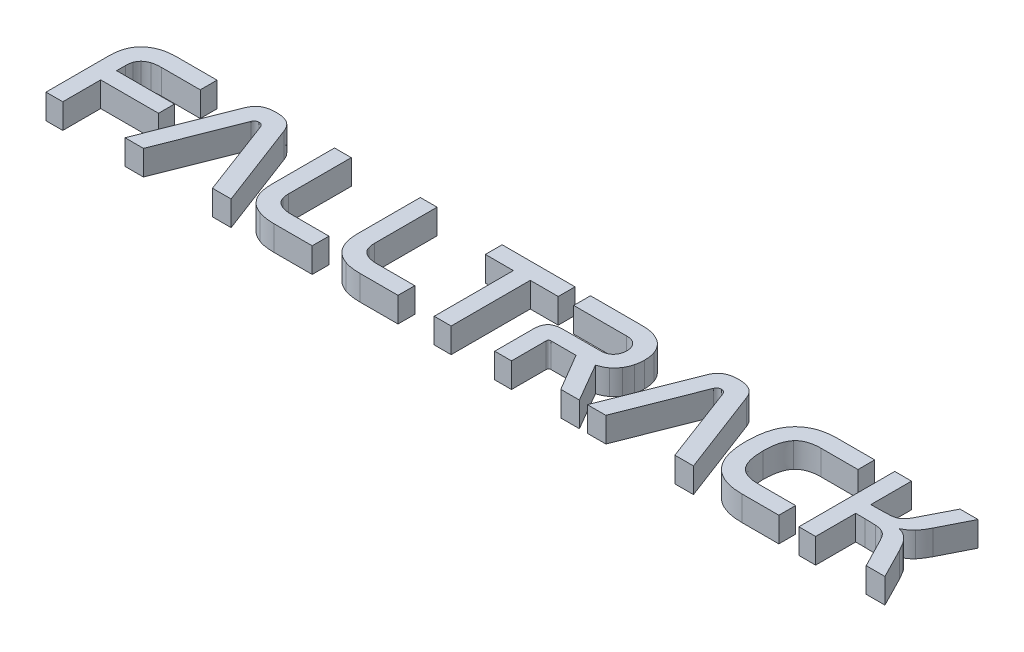
from build123d import *

# Parameters (mm, degrees)
SKETCH1_W               = 41
SKETCH1_H               = 47
SKETCH1_W_2             = 37
SKETCH1_H_2             = 43
BOSS_EXTRUDE1_DEPTH     = 6
SKETCH2_W               = 41
SKETCH2_H               = 47
BOSS_EXTRUDE2_DEPTH     = 2
FILLET1_R               = 4
SKETCH4_R               = 0.95
BOSS_EXTRUDE3_DEPTH     = 5
SKETCH6_W               = 25
SKETCH6_H               = 16.5
CUT_EXTRUDE1_DEPTH      = 32.756889016
SKETCH7_W               = 1.904325197
SKETCH7_H               = 4
BOSS_EXTRUDE4_DEPTH     = 5
SKETCH8_R               = 1.95
BOSS_EXTRUDE5_DEPTH     = 3
FILLET2_R               = 2
SKETCH9_W               = 2
SKETCH9_H               = 10
CUT_EXTRUDE2_DEPTH      = 6
FILLET3_R               = 3
CUT_EXTRUDE3_DEPTH      = 5
CUT_EXTRUDE3_DEPTH_BACK = 47.230401253
SKETCH11_W              = 28
SKETCH11_H              = 3.5
BOSS_EXTRUDE6_DEPTH     = 1.5
CHAMFER1_SIZE           = 1
CHAMFER2_SIZE           = 0.5
SKETCH12_W              = 28
SKETCH12_H              = 0.8
BOSS_EXTRUDE7_DEPTH     = 0.65
CHAMFER3_SIZE           = 0.5
SKETCH13_W              = 6
SKETCH13_H              = 3.5
BOSS_EXTRUDE8_DEPTH     = 1.5
CHAMFER4_SIZE           = 2
SKETCH14_W              = 6
SKETCH14_H              = 0.8
BOSS_EXTRUDE9_DEPTH     = 0.65
CHAMFER5_SIZE           = 0.5
BOSS_EXTRUDE10_DEPTH    = 1
CUT_EXTRUDE5_DEPTH      = 33.457664762
CUT_EXTRUDE5_DEPTH_BACK = 33.457664762
SKETCH16_W              = 45.549164248
SKETCH16_H              = 15.08771914


# Read off the part's stored shape, not the designer's step: Boss-Extrude10
# Some blends are built 0.0001 mm under size
with BuildPart() as part:
    # Sketch1 → Boss-Extrude1 (new body)
    with BuildSketch(Plane(origin=(0, 0, 0), x_dir=(1, 0, 0), z_dir=(0, 1, 0))):
        Rectangle(SKETCH1_W, SKETCH1_H)
        Rectangle(SKETCH1_W_2, SKETCH1_H_2, mode=Mode.SUBTRACT)
    extrude(amount=BOSS_EXTRUDE1_DEPTH)

    # Sketch2 → Boss-Extrude2 (add)
    with BuildSketch(Plane(origin=(0, 6, 0), x_dir=(1, 0, 0), z_dir=(0, 1, 0))):
        Rectangle(SKETCH2_W, SKETCH2_H)
    extrude(amount=BOSS_EXTRUDE2_DEPTH)

    # Fillet1
    fillet1_edges = [part.edges().sort_by_distance(p)[0] for p in [
        (20.5, 4, -23.5),
        (20.5, 4, 23.5),
        (-20.5, 4, 23.5),
        (-20.5, 4, -23.5),
    ]]
    fillet(fillet1_edges, radius=FILLET1_R)

    # Sketch4 → Boss-Extrude3 (add)
    with BuildSketch(Plane.XZ.offset(-6)):
        with Locations(Location((11.05, -3.55, 0), (0, 0, 90))):
            Circle(SKETCH4_R)
        with Locations(Location((11.05, 18.55, 0), (0, 0, 270))):
            Circle(SKETCH4_R)
        with Locations(Location((-11.05, -3.55, 0), (0, 0, 90))):
            Circle(SKETCH4_R)
        with Locations(Location((-11.05, 18.55, 0), (0, 0, 90))):
            Circle(SKETCH4_R)
    extrude(amount=BOSS_EXTRUDE3_DEPTH)

    # Sketch6 → Cut-Extrude1 (cut, through all)
    with BuildSketch(Plane.XZ.offset(-6)):
        with Locations((0, 7.75)):
            Rectangle(SKETCH6_W, SKETCH6_H)
    extrude(amount=-CUT_EXTRUDE1_DEPTH, mode=Mode.SUBTRACT)

    # Sketch7 → Boss-Extrude4 (add)
    with BuildSketch(Plane.XZ.offset(-6)):
        Polygon((-14, -19.5), (-14, -21.5), (-18.5, -21.5), (-18.5, -17), (-16.5, -17), (-16.5, -19.5), align=None)
        Polygon((-14, -5.5), (-14, -3.5), (-18.5, -3.5), (-18.5, -8), (-16.5, -8), (-16.5, -5.5), align=None)
        with Locations((2.452162599, -12.5)):
            Rectangle(SKETCH7_W, SKETCH7_H)
    extrude(amount=BOSS_EXTRUDE4_DEPTH)

    # Sketch8 → Boss-Extrude5 (add)
    with BuildSketch(Plane.XZ.offset(-6)):
        with Locations(Location((11.05, -3.55, 0), (0, 0, 90))):
            Circle(SKETCH8_R)
        with Locations(Location((-11.05, -3.55, 0), (0, 0, 90))):
            Circle(SKETCH8_R)
        with Locations(Location((11.05, 18.55, 0), (0, 0, 90))):
            Circle(SKETCH8_R)
        with Locations(Location((-11.05, 18.55, 0), (0, 0, 90))):
            Circle(SKETCH8_R)
    extrude(amount=BOSS_EXTRUDE5_DEPTH)

    # Fillet2
    fillet2_edges = [part.edges().sort_by_distance(p)[0] for p in [
        (0, 8, 23.5),
        (-20.5, 8, 0),
        (20.5, 8, 0),
        (0, 8, -23.5),
        (-19.328427125, 8, -22.328427125),
        (19.328427125, 8, -22.328427125),
        (19.328427125, 8, 22.328427125),
        (-19.328427125, 8, 22.328427125),
    ]]
    fillet(fillet2_edges, radius=FILLET2_R)

    # Sketch9 → Cut-Extrude2 (cut)
    with BuildSketch(Plane.XZ):
        with Locations((19.5, 0.5)):
            Rectangle(SKETCH9_W, SKETCH9_H)
    extrude(amount=-CUT_EXTRUDE2_DEPTH, mode=Mode.SUBTRACT)

    # Fillet3
    fillet3_edges = [part.edges().sort_by_distance(p)[0] for p in [
        (19.5, 6, 5.5),
        (19.5, 6, -4.5),
    ]]
    fillet(fillet3_edges, radius=FILLET3_R)
    fillet3_2_edges = [part.edges().sort_by_distance(p)[0] for p in [
        (19.5, 0, 5.5),
        (19.5, 0, -4.5),
    ]]
    fillet(fillet3_2_edges, radius=FILLET3_R - 0.0001)  # a hair under: the kernel refuses the full size

    # Sketch10 → Cut-Extrude3 (cut, two sides: drawn at the far end of the back side and taken through both)
    with BuildSketch(Plane(origin=(-18.5, 0, 0), x_dir=(0, 0, -1), z_dir=(1, 0, 0)).offset(-CUT_EXTRUDE3_DEPTH_BACK)):
        with BuildLine():
            Line((8.5, 5), (16.5, 5))
            ThreePointArc((16.5, 5), (18, 3.5), (16.5, 2))
            Line((16.5, 2), (8.5, 2))
            ThreePointArc((8.5, 2), (7, 3.5), (8.5, 5))
        make_face()
    extrude(amount=CUT_EXTRUDE3_DEPTH + CUT_EXTRUDE3_DEPTH_BACK, mode=Mode.SUBTRACT)

    # Sketch11 → Boss-Extrude6 (add)
    with BuildSketch(Plane(origin=(-18.5, 0, 0), x_dir=(0, 0, -1), z_dir=(1, 0, 0))):
        with Locations((0, -0.75)):
            Rectangle(SKETCH11_W, SKETCH11_H)
    extrude(amount=BOSS_EXTRUDE6_DEPTH)

    # Chamfer1
    chamfer1_edges = [part.edges().sort_by_distance(p)[0] for p in [
        (-18.5, 1, -11),
        (-18.5, 1, 5.25),
    ]]
    chamfer(chamfer1_edges, length=CHAMFER1_SIZE - 0.0001)  # a hair under: the kernel refuses the full size

    # Chamfer2
    chamfer2_edges = [part.edges().sort_by_distance(p)[0] for p in [
        (-17, 1, 5.25),
        (-17, 1, -11),
    ]]
    chamfer(chamfer2_edges, length=CHAMFER2_SIZE)

    # Sketch12 → Boss-Extrude7 (add)
    with BuildSketch(Plane.ZY.offset(18.5)):
        with Locations((0, -2.1)):
            Rectangle(SKETCH12_W, SKETCH12_H)
    extrude(amount=BOSS_EXTRUDE7_DEPTH)

    # Chamfer3
    chamfer3_edges = [part.edges().sort_by_distance(p)[0] for p in [
        (-18.5, -1.7, 0),
    ]]
    chamfer(chamfer3_edges, length=CHAMFER3_SIZE)

    # Sketch13 → Boss-Extrude8 (add)
    with BuildSketch(Plane.ZY.offset(-18.5)):
        with Locations((10.5, -0.75)):
            Rectangle(SKETCH13_W, SKETCH13_H)
        with Locations((-11.5, -0.75)):
            Rectangle(SKETCH13_W, SKETCH13_H)
    extrude(amount=BOSS_EXTRUDE8_DEPTH)

    # Chamfer4
    # the kernel refuses this chamfer: 2 mm, written as the material it adds along each edge
    with BuildSketch(Plane(origin=(18.5, 1, 7.5), x_dir=(0.027495876610585633, 0.9996219169112968, 0), z_dir=(0, 0, 1))) as chamfer4_piece_1_section:
        Polygon((CHAMFER4_SIZE * 0.999621916911, CHAMFER4_SIZE * 0.0274958766106), (-CHAMFER4_SIZE * 0.0274958766106, CHAMFER4_SIZE * 0.999621916911), (0, 0), align=None)
    chamfer4_piece_1 = extrude(amount=6, mode=Mode.PRIVATE)
    chamfer4_piece_1 = split(chamfer4_piece_1, bisect_by=Plane(origin=(17, 1.726620591, 9.333392509), z_dir=(1, 0, 0)), keep=Keep.TOP, mode=Mode.PRIVATE)
    add(chamfer4_piece_1)
    with BuildSketch(Plane(origin=(18.5, 1, -14.5), x_dir=(0.027495876610583895, 0.9996219169112968, 0), z_dir=(0, 0, 1))) as chamfer4_piece_2_section:
        Polygon((CHAMFER4_SIZE * 0.999621916911, CHAMFER4_SIZE * 0.0274958766106), (-CHAMFER4_SIZE * 0.0274958766106, CHAMFER4_SIZE * 0.999621916911), (0, 0), align=None)
    chamfer4_piece_2 = extrude(amount=6, mode=Mode.PRIVATE)
    chamfer4_piece_2 = split(chamfer4_piece_2, bisect_by=Plane(origin=(17, 1.677615673, -12.321825501), z_dir=(1, 0, 0)), keep=Keep.TOP, mode=Mode.PRIVATE)
    add(chamfer4_piece_2)

    # Sketch14 → Boss-Extrude9 (add)
    with BuildSketch(Plane(origin=(18.5, 0, 0), x_dir=(0, 0, -1), z_dir=(1, 0, 0))):
        with Locations((11.5, -2.1)):
            Rectangle(SKETCH14_W, SKETCH14_H)
        with Locations((-10.5, -2.1)):
            Rectangle(SKETCH14_W, SKETCH14_H)
    extrude(amount=BOSS_EXTRUDE9_DEPTH)

    # Chamfer5
    chamfer5_edges = [part.edges().sort_by_distance(p)[0] for p in [
        (-17, -2.5, 0),
        (17, -2.5, 10.5),
        (17, -2.5, -11.5),
        (18.5, -1.7, -11.5),
        (18.5, -1.7, 10.5),
    ]]
    chamfer(chamfer5_edges, length=CHAMFER5_SIZE)

    # Boss-Extrude10 outline → Boss-Extrude10 (add)
    with BuildSketch(Plane(origin=(0, 8, 0), x_dir=(1, 0, 0), z_dir=(0, 1, 0))):
        with BuildLine():
            add(Edge.make_bspline(
                [(-15.641636125, 14.589955584), (-15.460716936, 14.656618182), (-15.242590715, 14.689949481), (-14.987257463, 14.689949481)],
                knots=[16, 16, 16, 16, 17, 17, 17, 17], degree=3))
            add(Edge.make_bspline(
                [(-16.084554826, 14.312763201), (-15.970298235, 14.430818011), (-15.822632829, 14.523292987), (-15.641636125, 14.589955584)],
                knots=[15, 15, 15, 15, 16, 16, 16, 16], degree=3))
            add(Edge.make_bspline(
                [(-16.333144304, 13.892711322), (-16.281752092, 14.054639422), (-16.198888933, 14.194630877), (-16.084554826, 14.312763201)],
                knots=[14, 14, 14, 14, 15, 15, 15, 15], degree=3))
            add(Edge.make_bspline(
                [(-16.410348894, 13.35840285), (-16.410348894, 13.552732074), (-16.38461403, 13.730783221), (-16.333144304, 13.892711322)],
                knots=[13, 13, 13, 13, 14, 14, 14, 14], degree=3))
            Line((-16.410348894, 13.35840285), (-16.410348894, 10.832355488))
            Line((-16.410348894, 10.832355488), (-15.735971452, 10.832355488))
            Line((-15.735971452, 10.832355488), (-15.735971452, 12.358231342))
            Line((-15.735971452, 12.358231342), (-13.409911883, 12.358231342))
            Line((-13.409911883, 12.358231342), (-13.409911883, 12.998347308))
            Line((-13.409911883, 12.998347308), (-15.735971452, 12.998347308))
            Line((-15.735971452, 12.998347308), (-15.735971452, 13.364138934))
            add(Edge.make_bspline(
                [(-15.698841936, 13.618386981), (-15.723646623, 13.540252215), (-15.735971452, 13.455528705), (-15.735971452, 13.364138934)],
                knots=[5, 5, 5, 5, 6, 6, 6, 6], degree=3))
            add(Edge.make_bspline(
                [(-15.570245134, 13.824188373), (-15.631171648, 13.765044696), (-15.674037248, 13.696444232), (-15.698841936, 13.618386981)],
                knots=[4, 4, 4, 4, 5, 5, 5, 5], degree=3))
            add(Edge.make_bspline(
                [(-15.324446184, 13.964179828), (-15.427308122, 13.929918353), (-15.50931862, 13.88317702), (-15.570245134, 13.824188373)],
                knots=[3, 3, 3, 3, 4, 4, 4, 4], degree=3))
            add(Edge.make_bspline(
                [(-14.941601335, 14.015572039), (-15.093995134, 14.015572039), (-15.221584245, 13.998441302), (-15.324446184, 13.964179828)],
                knots=[2, 2, 2, 2, 3, 3, 3, 3], degree=3))
            Line((-14.941601335, 14.015572039), (-13.387122576, 14.015572039))
            Line((-13.387122576, 14.015572039), (-13.387122576, 14.689949481))
            Line((-13.387122576, 14.689949481), (-14.987257463, 14.689949481))
        make_face()
        with BuildLine():
            add(Edge.make_bspline(
                [(-11.07245766, 14.067041766), (-11.163924945, 14.067041766), (-11.228727191, 14.023168475), (-11.266786883, 13.935576922)],
                knots=[10, 10, 10, 10, 11, 11, 11, 11], degree=3))
            add(Edge.make_bspline(
                [(-10.88386452, 13.935576922), (-10.918125995, 14.023168475), (-10.980990374, 14.067041766), (-11.07245766, 14.067041766)],
                knots=[9, 9, 9, 9, 10, 10, 10, 10], degree=3))
            Line((-10.88386452, 13.935576922), (-9.712308124, 10.832355488))
            Line((-9.712308124, 10.832355488), (-8.963594135, 10.832355488))
            Line((-8.963594135, 10.832355488), (-10.266615375, 14.26137099))
            add(Edge.make_bspline(
                [(-10.566674579, 14.64708388), (-10.435209735, 14.572824847), (-10.335215838, 14.444228045), (-10.266615375, 14.26137099)],
                knots=[5, 5, 5, 5, 6, 6, 6, 6], degree=3))
            add(Edge.make_bspline(
                [(-11.066721576, 14.758549945), (-10.864873431, 14.758549945), (-10.698139422, 14.721420428), (-10.566674579, 14.64708388)],
                knots=[4, 4, 4, 4, 5, 5, 5, 5], degree=3))
            add(Edge.make_bspline(
                [(-11.572504657, 14.64708388), (-11.441039813, 14.721420428), (-11.272445453, 14.758549945), (-11.066721576, 14.758549945)],
                knots=[3, 3, 3, 3, 4, 4, 4, 4], degree=3))
            add(Edge.make_bspline(
                [(-11.878299945, 14.26137099), (-11.805978778, 14.444228045), (-11.7039695, 14.572824847), (-11.572504657, 14.64708388)],
                knots=[2, 2, 2, 2, 3, 3, 3, 3], degree=3))
            Line((-11.878299945, 14.26137099), (-13.232713396, 10.832355488))
            Line((-13.232713396, 10.832355488), (-12.489813006, 10.832355488))
            Line((-12.489813006, 10.832355488), (-11.266786883, 13.935576922))
        make_face()
        with BuildLine():
            add(Edge.make_bspline(
                [(-8.583539814, 11.629593647), (-8.63500954, 11.791521747), (-8.660666889, 11.969650409), (-8.660666889, 12.163979633)],
                knots=[11, 11, 11, 11, 12, 12, 12, 12], degree=3))
            add(Edge.make_bspline(
                [(-8.334950336, 11.209541767), (-8.449206928, 11.327596576), (-8.532147602, 11.467588031), (-8.583539814, 11.629593647)],
                knots=[10, 10, 10, 10, 11, 11, 11, 11], degree=3))
            add(Edge.make_bspline(
                [(-7.892031635, 10.932349384), (-8.073028339, 10.999011982), (-8.22061623, 11.091409443), (-8.334950336, 11.209541767)],
                knots=[9, 9, 9, 9, 10, 10, 10, 10], degree=3))
            add(Edge.make_bspline(
                [(-7.237652973, 10.832355488), (-7.492986225, 10.832355488), (-7.711112446, 10.865686786), (-7.892031635, 10.932349384)],
                knots=[8, 8, 8, 8, 9, 9, 9, 9], degree=3))
            Line((-7.237652973, 10.832355488), (-5.700304951, 10.832355488))
            Line((-5.700304951, 10.832355488), (-5.700304951, 11.506732929))
            Line((-5.700304951, 11.506732929), (-7.197655414, 11.506732929))
            add(Edge.make_bspline(
                [(-7.577709736, 11.558125141), (-7.476785663, 11.523863666), (-7.350049213, 11.506732929), (-7.197655414, 11.506732929)],
                knots=[4, 4, 4, 4, 5, 5, 5, 5], degree=3))
            add(Edge.make_bspline(
                [(-7.820563129, 11.69819411), (-7.75971413, 11.639050434), (-7.678711323, 11.59246413), (-7.577709736, 11.558125141)],
                knots=[3, 3, 3, 3, 4, 4, 4, 4], degree=3))
            add(Edge.make_bspline(
                [(-7.949159931, 11.909654071), (-7.924432758, 11.827643573), (-7.881567157, 11.757182758), (-7.820563129, 11.69819411)],
                knots=[2, 2, 2, 2, 3, 3, 3, 3], degree=3))
            add(Edge.make_bspline(
                [(-7.986289447, 12.169638202), (-7.986289447, 12.078248432), (-7.974042133, 11.99150954), (-7.949159931, 11.909654071)],
                knots=[1, 1, 1, 1, 2, 2, 2, 2], degree=3))
            Line((-7.986289447, 12.169638202), (-7.986289447, 14.689949481))
            Line((-7.986289447, 14.689949481), (-8.660666889, 14.689949481))
            Line((-8.660666889, 14.689949481), (-8.660666889, 12.163979633))
        make_face()
        with BuildLine():
            add(Edge.make_bspline(
                [(-5.13165749, 11.629593647), (-5.183127217, 11.791521747), (-5.208784565, 11.969650409), (-5.208784565, 12.163979633)],
                knots=[11, 11, 11, 11, 12, 12, 12, 12], degree=3))
            add(Edge.make_bspline(
                [(-4.883068013, 11.209541767), (-4.997324604, 11.327596576), (-5.080265278, 11.467588031), (-5.13165749, 11.629593647)],
                knots=[10, 10, 10, 10, 11, 11, 11, 11], degree=3))
            add(Edge.make_bspline(
                [(-4.440149312, 10.932349384), (-4.621146016, 10.999011982), (-4.768733906, 11.091409443), (-4.883068013, 11.209541767)],
                knots=[9, 9, 9, 9, 10, 10, 10, 10], degree=3))
            add(Edge.make_bspline(
                [(-3.78577065, 10.832355488), (-4.041103902, 10.832355488), (-4.259230122, 10.865686786), (-4.440149312, 10.932349384)],
                knots=[8, 8, 8, 8, 9, 9, 9, 9], degree=3))
            Line((-3.78577065, 10.832355488), (-2.248422628, 10.832355488))
            Line((-2.248422628, 10.832355488), (-2.248422628, 11.506732929))
            Line((-2.248422628, 11.506732929), (-3.745773091, 11.506732929))
            add(Edge.make_bspline(
                [(-4.125827412, 11.558125141), (-4.02490334, 11.523863666), (-3.89816689, 11.506732929), (-3.745773091, 11.506732929)],
                knots=[4, 4, 4, 4, 5, 5, 5, 5], degree=3))
            add(Edge.make_bspline(
                [(-4.368680806, 11.69819411), (-4.307831807, 11.639050434), (-4.226828999, 11.59246413), (-4.125827412, 11.558125141)],
                knots=[3, 3, 3, 3, 4, 4, 4, 4], degree=3))
            add(Edge.make_bspline(
                [(-4.497277608, 11.909654071), (-4.472550435, 11.827643573), (-4.429684834, 11.757182758), (-4.368680806, 11.69819411)],
                knots=[2, 2, 2, 2, 3, 3, 3, 3], degree=3))
            add(Edge.make_bspline(
                [(-4.534407124, 12.169638202), (-4.534407124, 12.078248432), (-4.52215981, 11.99150954), (-4.497277608, 11.909654071)],
                knots=[1, 1, 1, 1, 2, 2, 2, 2], degree=3))
            Line((-4.534407124, 12.169638202), (-4.534407124, 14.689949481))
            Line((-4.534407124, 14.689949481), (-5.208784565, 14.689949481))
            Line((-5.208784565, 14.689949481), (-5.208784565, 12.163979633))
        make_face()
        with BuildLine():
            add(Edge.make_bspline(
                [(4.160798562, 13.864185931), (4.075067361, 13.965032489), (3.938796609, 14.015572039), (3.75221885, 14.015572039)],
                knots=[24, 24, 24, 24, 25, 25, 25, 25], degree=3))
            add(Edge.make_bspline(
                [(4.289395364, 13.506998431), (4.289395364, 13.644121844), (4.246529763, 13.763184344), (4.160798562, 13.864185931)],
                knots=[23, 23, 23, 23, 24, 24, 24, 24], degree=3))
            add(Edge.make_bspline(
                [(4.258001931, 13.306933124), (4.278853372, 13.371657855), (4.289395364, 13.438397967), (4.289395364, 13.506998431)],
                knots=[22, 22, 22, 22, 23, 23, 23, 23], degree=3))
            add(Edge.make_bspline(
                [(4.163666604, 13.135470721), (4.205524514, 13.185002582), (4.236995462, 13.242130878), (4.258001931, 13.306933124)],
                knots=[21, 21, 21, 21, 22, 22, 22, 22], degree=3))
            add(Edge.make_bspline(
                [(3.997940286, 13.015478046), (4.06654075, 13.045941302), (4.121731179, 13.085938861), (4.163666604, 13.135470721)],
                knots=[20, 20, 20, 20, 21, 21, 21, 21], degree=3))
            add(Edge.make_bspline(
                [(3.75221885, 12.969744403), (3.847406839, 12.969744403), (3.929339822, 12.984937274), (3.997940286, 13.015478046)],
                knots=[19, 19, 19, 19, 20, 20, 20, 20], degree=3))
            Line((3.75221885, 12.969744403), (2.249132303, 12.969744403))
            add(Edge.make_bspline(
                [(1.786214823, 12.826884906), (1.881402811, 12.922072894), (2.035734476, 12.969744403), (2.249132303, 12.969744403)],
                knots=[17, 17, 17, 17, 18, 18, 18, 18], degree=3))
            add(Edge.make_bspline(
                [(1.643355326, 12.358231342), (1.643355326, 12.575427387), (1.69094932, 12.731619403), (1.786214823, 12.826884906)],
                knots=[16, 16, 16, 16, 17, 17, 17, 17], degree=3))
            Line((1.643355326, 12.358231342), (1.643355326, 10.832355488))
            Line((1.643355326, 10.832355488), (2.317732767, 10.832355488))
            Line((2.317732767, 10.832355488), (2.317732767, 12.226844013))
            add(Edge.make_bspline(
                [(2.414858621, 12.323969867), (2.350056375, 12.323969867), (2.317732767, 12.291568744), (2.317732767, 12.226844013)],
                knots=[12, 12, 12, 12, 13, 13, 13, 13], degree=3))
            Line((2.414858621, 12.323969867), (3.420688699, 12.323969867))
            Line((3.420688699, 12.323969867), (4.300790017, 10.832355488))
            Line((4.300790017, 10.832355488), (5.049504006, 10.832355488))
            Line((5.049504006, 10.832355488), (4.152271951, 12.375439594))
            add(Edge.make_bspline(
                [(4.52945823, 12.558296649), (4.426596292, 12.478301532), (4.300790017, 12.417297504), (4.152271951, 12.375439594)],
                knots=[7, 7, 7, 7, 8, 8, 8, 8], degree=3))
            add(Edge.make_bspline(
                [(4.78091575, 12.835489032), (4.716035989, 12.730611713), (4.632320169, 12.638291766), (4.52945823, 12.558296649)],
                knots=[6, 6, 6, 6, 7, 7, 7, 7], degree=3))
            add(Edge.make_bspline(
                [(4.923775247, 13.172677753), (4.893234475, 13.052607562), (4.845640481, 12.940211322), (4.78091575, 12.835489032)],
                knots=[5, 5, 5, 5, 6, 6, 6, 6], degree=3))
            add(Edge.make_bspline(
                [(4.969508889, 13.535523822), (4.969508889, 13.41359328), (4.954238503, 13.292670428), (4.923775247, 13.172677753)],
                knots=[4, 4, 4, 4, 5, 5, 5, 5], degree=3))
            add(Edge.make_bspline(
                [(4.898040383, 13.975574481), (4.945634377, 13.834575335), (4.969508889, 13.687917621), (4.969508889, 13.535523822)],
                knots=[3, 3, 3, 3, 4, 4, 4, 4], degree=3))
            add(Edge.make_bspline(
                [(4.675185769, 14.344234149), (4.776032327, 14.239356829), (4.850368875, 14.116496112), (4.898040383, 13.975574481)],
                knots=[2, 2, 2, 2, 3, 3, 3, 3], degree=3))
            add(Edge.make_bspline(
                [(4.289395364, 14.595691668), (4.44558738, 14.532827288), (4.574184182, 14.448956439), (4.675185769, 14.344234149)],
                knots=[1, 1, 1, 1, 2, 2, 2, 2], degree=3))
            add(Edge.make_bspline(
                [(3.729352029, 14.689949481), (3.946470559, 14.689949481), (4.133125833, 14.658556048), (4.289395364, 14.595691668)],
                knots=[0, 0, 0, 0, 1, 1, 1, 1], degree=3))
            Line((3.729352029, 14.689949481), (1.637619242, 14.689949481))
            Line((1.637619242, 14.689949481), (1.637619242, 14.015572039))
            Line((1.637619242, 14.015572039), (3.75221885, 14.015572039))
        make_face()
        with BuildLine():
            add(Edge.make_bspline(
                [(7.529817726, 14.067041766), (7.438350441, 14.067041766), (7.373548195, 14.023168475), (7.335488503, 13.935576922)],
                knots=[10, 10, 10, 10, 11, 11, 11, 11], degree=3))
            add(Edge.make_bspline(
                [(7.718410866, 13.935576922), (7.684149391, 14.023168475), (7.621285012, 14.067041766), (7.529817726, 14.067041766)],
                knots=[9, 9, 9, 9, 10, 10, 10, 10], degree=3))
            Line((7.718410866, 13.935576922), (8.889967262, 10.832355488))
            Line((8.889967262, 10.832355488), (9.638681251, 10.832355488))
            Line((9.638681251, 10.832355488), (8.335660011, 14.26137099))
            add(Edge.make_bspline(
                [(8.035600807, 14.64708388), (8.167065651, 14.572824847), (8.267059547, 14.444228045), (8.335660011, 14.26137099)],
                knots=[5, 5, 5, 5, 6, 6, 6, 6], degree=3))
            add(Edge.make_bspline(
                [(7.53555381, 14.758549945), (7.737401955, 14.758549945), (7.904135964, 14.721420428), (8.035600807, 14.64708388)],
                knots=[4, 4, 4, 4, 5, 5, 5, 5], degree=3))
            add(Edge.make_bspline(
                [(7.029770729, 14.64708388), (7.161235573, 14.721420428), (7.329829933, 14.758549945), (7.53555381, 14.758549945)],
                knots=[3, 3, 3, 3, 4, 4, 4, 4], degree=3))
            add(Edge.make_bspline(
                [(6.723975441, 14.26137099), (6.796296608, 14.444228045), (6.898305886, 14.572824847), (7.029770729, 14.64708388)],
                knots=[2, 2, 2, 2, 3, 3, 3, 3], degree=3))
            Line((6.723975441, 14.26137099), (5.36956199, 10.832355488))
            Line((5.36956199, 10.832355488), (6.11246238, 10.832355488))
            Line((6.11246238, 10.832355488), (7.335488503, 13.935576922))
        make_face()
        with BuildLine():
            add(Edge.make_bspline(
                [(10.287246315, 14.212769305), (10.586297828, 14.530889422), (11.017821876, 14.689949481), (11.581740943, 14.689949481)],
                knots=[12, 12, 12, 12, 13, 13, 13, 13], degree=3))
            add(Edge.make_bspline(
                [(9.83859153, 12.758284442), (9.83859153, 13.409795062), (9.988117286, 13.894649188), (10.287246315, 14.212769305)],
                knots=[11, 11, 11, 11, 12, 12, 12, 12], degree=3))
            add(Edge.make_bspline(
                [(10.287246315, 11.309535663), (9.988117286, 11.62765578), (9.83859153, 12.11057204), (9.83859153, 12.758284442)],
                knots=[10, 10, 10, 10, 11, 11, 11, 11], degree=3))
            add(Edge.make_bspline(
                [(11.581740943, 10.832355488), (11.017821876, 10.832355488), (10.586297828, 10.991415546), (10.287246315, 11.309535663)],
                knots=[9, 9, 9, 9, 10, 10, 10, 10], degree=3))
            Line((11.581740943, 10.832355488), (13.073355323, 10.832355488))
            Line((13.073355323, 10.832355488), (13.073355323, 11.506732929))
            Line((13.073355323, 11.506732929), (11.581740943, 11.506732929))
            add(Edge.make_bspline(
                [(10.76442649, 11.801056049), (10.932090675, 11.604788959), (11.204477149, 11.506732929), (11.581740943, 11.506732929)],
                knots=[5, 5, 5, 5, 6, 6, 6, 6], degree=3))
            add(Edge.make_bspline(
                [(10.512968971, 12.758284442), (10.512968971, 12.316295917), (10.596762306, 11.997245624), (10.76442649, 11.801056049)],
                knots=[4, 4, 4, 4, 5, 5, 5, 5], degree=3))
            add(Edge.make_bspline(
                [(10.767294532, 13.721326434), (10.597769996, 13.52498183), (10.512968971, 13.204071185), (10.512968971, 12.758284442)],
                knots=[3, 3, 3, 3, 4, 4, 4, 4], degree=3))
            add(Edge.make_bspline(
                [(11.581740943, 14.015572039), (11.208275367, 14.015572039), (10.936819068, 13.917438495), (10.767294532, 13.721326434)],
                knots=[2, 2, 2, 2, 3, 3, 3, 3], degree=3))
            Line((11.581740943, 14.015572039), (13.073355323, 14.015572039))
            Line((13.073355323, 14.015572039), (13.073355323, 14.689949481))
            Line((13.073355323, 14.689949481), (11.581740943, 14.689949481))
        make_face()
        with BuildLine():
            add(Edge.make_bspline(
                [(15.370734472, 12.429699847), (15.256400366, 12.439156635), (15.107804785, 12.443962543), (14.924947729, 12.443962543)],
                knots=[21, 21, 21, 21, 22, 22, 22, 22], degree=3))
            add(Edge.make_bspline(
                [(15.656453467, 12.363967426), (15.580179052, 12.3982289), (15.484991064, 12.420165546), (15.370734472, 12.429699847)],
                knots=[20, 20, 20, 20, 21, 21, 21, 21], degree=3))
            add(Edge.make_bspline(
                [(15.845046606, 12.221107929), (15.795514746, 12.282034442), (15.732650366, 12.329705951), (15.656453467, 12.363967426)],
                knots=[19, 19, 19, 19, 20, 20, 20, 20], degree=3))
            add(Edge.make_bspline(
                [(15.999378271, 11.975386493), (15.945970678, 12.078248432), (15.894500952, 12.1601039), (15.845046606, 12.221107929)],
                knots=[18, 18, 18, 18, 19, 19, 19, 19], degree=3))
            Line((15.999378271, 11.975386493), (16.588024511, 10.832355488))
            Line((16.588024511, 10.832355488), (17.34239707, 10.832355488))
            Line((17.34239707, 10.832355488), (16.719489355, 12.043909442))
            add(Edge.make_bspline(
                [(16.553685522, 12.332573993), (16.6070156, 12.250563495), (16.662283544, 12.154367816), (16.719489355, 12.043909442)],
                knots=[14, 14, 14, 14, 15, 15, 15, 15], degree=3))
            add(Edge.make_bspline(
                [(16.385091162, 12.544033954), (16.444157324, 12.484890277), (16.500355444, 12.414429462), (16.553685522, 12.332573993)],
                knots=[13, 13, 13, 13, 14, 14, 14, 14], degree=3))
            add(Edge.make_bspline(
                [(16.193707495, 12.69255202), (16.262230444, 12.652554462), (16.326025, 12.603022601), (16.385091162, 12.544033954)],
                knots=[12, 12, 12, 12, 13, 13, 13, 13], degree=3))
            add(Edge.make_bspline(
                [(15.953644629, 12.786887347), (16.045111914, 12.764020526), (16.125107031, 12.732627093), (16.193707495, 12.69255202)],
                knots=[11, 11, 11, 11, 12, 12, 12, 12], degree=3))
            add(Edge.make_bspline(
                [(16.342225561, 13.061211688), (16.24316184, 12.946877582), (16.113634863, 12.855487811), (15.953644629, 12.786887347)],
                knots=[10, 10, 10, 10, 11, 11, 11, 11], degree=3))
            add(Edge.make_bspline(
                [(16.622285986, 13.489867694), (16.534616918, 13.318405292), (16.441289282, 13.17546828), (16.342225561, 13.061211688)],
                knots=[9, 9, 9, 9, 10, 10, 10, 10], degree=3))
            Line((16.622285986, 13.489867694), (17.228062963, 14.689949481))
            Line((17.228062963, 14.689949481), (16.50229331, 14.689949481))
            Line((16.50229331, 14.689949481), (15.91364707, 13.535523822))
            add(Edge.make_bspline(
                [(15.762183447, 13.28119826), (15.809777441, 13.34406264), (15.860239477, 13.428863666), (15.91364707, 13.535523822)],
                knots=[5, 5, 5, 5, 6, 6, 6, 6], degree=3))
            add(Edge.make_bspline(
                [(15.587853003, 13.135470721), (15.656453467, 13.169809711), (15.714511938, 13.21833388), (15.762183447, 13.28119826)],
                knots=[4, 4, 4, 4, 5, 5, 5, 5], degree=3))
            add(Edge.make_bspline(
                [(15.327868872, 13.069815814), (15.432591162, 13.079272601), (15.519330053, 13.101209247), (15.587853003, 13.135470721)],
                knots=[3, 3, 3, 3, 4, 4, 4, 4], degree=3))
            add(Edge.make_bspline(
                [(14.924947729, 13.055475604), (15.088736182, 13.055475604), (15.222991553, 13.060203998), (15.327868872, 13.069815814)],
                knots=[2, 2, 2, 2, 3, 3, 3, 3], degree=3))
            Line((14.924947729, 13.055475604), (14.553497534, 13.055475604))
            Line((14.553497534, 13.055475604), (14.553497534, 14.689949481))
            Line((14.553497534, 14.689949481), (13.879120093, 14.689949481))
            Line((13.879120093, 14.689949481), (13.879120093, 10.832355488))
            Line((13.879120093, 10.832355488), (14.553497534, 10.832355488))
            Line((14.553497534, 10.832355488), (14.553497534, 12.443962543))
            Line((14.553497534, 12.443962543), (14.924947729, 12.443962543))
        make_face()
        Polygon((-0.791147237, 14.015572039), (-0.791147237, 10.832355488), (-0.111111227, 10.832355488), (-0.111111227, 14.015572039), (1.014789041, 14.015572039), (1.014789041, 14.689949481), (-1.917047506, 14.689949481), (-1.917047506, 14.015572039), align=None)
    extrude(amount=BOSS_EXTRUDE10_DEPTH)

    # Sketch16 → Cut-Extrude5 (cut, two sides: drawn at the far end of the back side and taken through both)
    with BuildSketch(Plane.XY.offset(-CUT_EXTRUDE5_DEPTH_BACK)):
        with Locations((0.112857196, 0.45614043)):
            Rectangle(SKETCH16_W, SKETCH16_H)
    extrude(amount=CUT_EXTRUDE5_DEPTH + CUT_EXTRUDE5_DEPTH_BACK, mode=Mode.SUBTRACT)


with BuildPart() as cut_extrude5_piece_1:
    # of the separate pieces the step leaves, piece 1, a body of its own (cut_extrude5_pieces)
    add(part.part.solids().sort_by_distance((4.289395364, 8, -13.506998431))[0])


with BuildPart() as cut_extrude5_piece_2:
    # of the separate pieces the step leaves, piece 2, a body of its own (cut_extrude5_pieces)
    add(part.part.solids().sort_by_distance((15.656453467, 8, -12.363967426))[0])


with BuildPart() as cut_extrude5_piece_3:
    # of the separate pieces the step leaves, piece 3, a body of its own (cut_extrude5_pieces)
    add(part.part.solids().sort_by_distance((7.718410866, 8, -13.935576922))[0])


with BuildPart() as cut_extrude5_piece_4:
    # of the separate pieces the step leaves, piece 4, a body of its own (cut_extrude5_pieces)
    add(part.part.solids().sort_by_distance((-10.88386452, 8, -13.935576922))[0])


with BuildPart() as cut_extrude5_piece_5:
    # of the separate pieces the step leaves, piece 5, a body of its own (cut_extrude5_pieces)
    add(part.part.solids().sort_by_distance((-16.084554826, 8, -14.312763201))[0])


with BuildPart() as cut_extrude5_piece_6:
    # of the separate pieces the step leaves, piece 6, a body of its own (cut_extrude5_pieces)
    add(part.part.solids().sort_by_distance((9.83859153, 8, -12.758284442))[0])


with BuildPart() as cut_extrude5_piece_7:
    # of the separate pieces the step leaves, piece 7, a body of its own (cut_extrude5_pieces)
    add(part.part.solids().sort_by_distance((-0.791147237, 8, -14.015572039))[0])


with BuildPart() as cut_extrude5_piece_8:
    # of the separate pieces the step leaves, piece 8, a body of its own (cut_extrude5_pieces)
    add(part.part.solids().sort_by_distance((-8.334950336, 8, -11.209541767))[0])


with BuildPart() as cut_extrude5_piece_9:
    # of the separate pieces the step leaves, piece 9, a body of its own (cut_extrude5_pieces)
    add(part.part.solids().sort_by_distance((-4.883068013, 8, -11.209541767))[0])


solid = Compound([cut_extrude5_piece_1.part, cut_extrude5_piece_2.part, cut_extrude5_piece_3.part, cut_extrude5_piece_4.part, cut_extrude5_piece_5.part, cut_extrude5_piece_6.part, cut_extrude5_piece_7.part, cut_extrude5_piece_8.part, cut_extrude5_piece_9.part])
